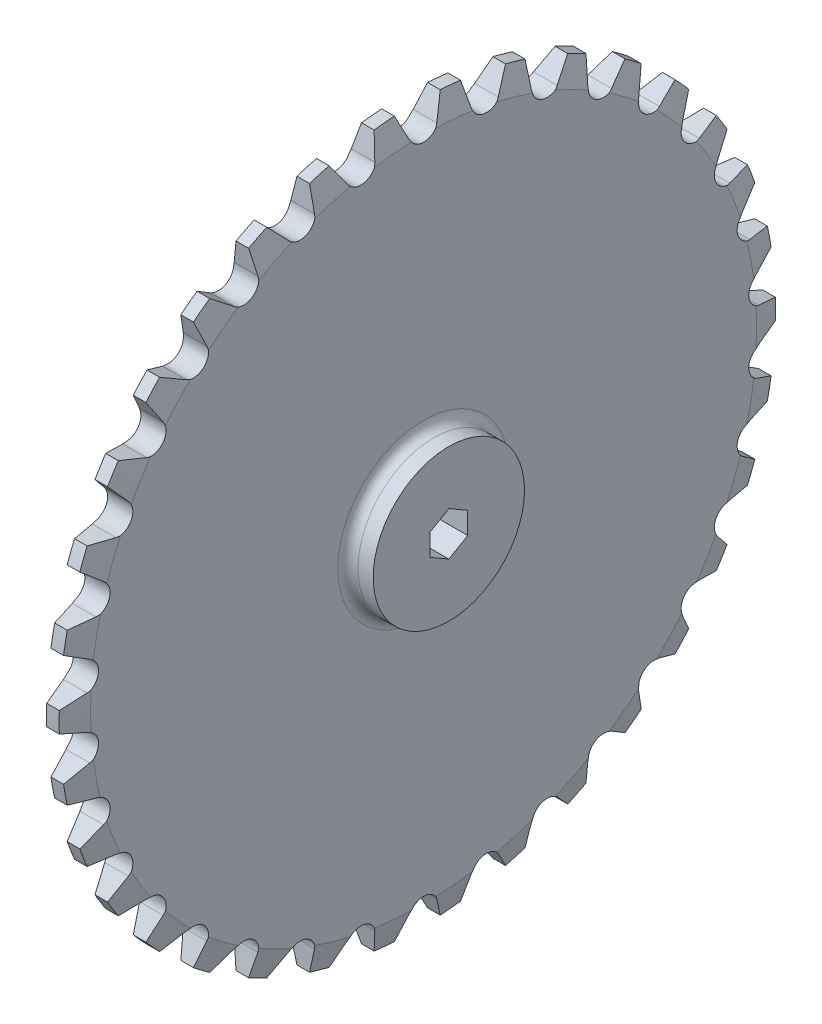
from build123d import *

# Parameters (mm, degrees)
CUT_EXTRUDE2_DEPTH      = 129.503982137
CIRPATTERN1_COUNT       = 34
CUT_EXTRUDE3_DEPTH      = 130.313516587
CUT_EXTRUDE3_DEPTH_BACK = 130.313516587
FILLET1_R               = 2.54


with BuildPart() as part:
    # Sketch1 → Revolve1 (revolve)
    with BuildSketch(Plane(origin=(0, 0, 0), x_dir=(1, 0, 0), z_dir=(0, 1, 0))):
        Polygon((-4.7625, 90.17), (-6.35, 83.82), (-6.35, 19.05), (-15.875, 19.05), (-15.875, 0), (6.35, 0), (6.35, 19.05), (0, 19.05), (0, 83.82), (-1.5875, 90.17), align=None)
    revolve(axis=Axis((0, 0, 0), (-1, 0, 0)))

    # Sketch2 → Cut-Extrude2 (cut, symmetric)
    with BuildSketch(Plane(origin=(0, 0, 0), x_dir=(0, 0, -1), z_dir=(1, 0, 0))):
        with BuildLine():
            ThreePointArc((-3.519981019, 84.568215737), (0, 82.216239614), (3.519981019, 84.568215737))
            Line((3.519981019, 84.568215737), (8.38006061, 96.3014858))
            Line((8.38006061, 96.3014858), (-8.38006061, 96.3014858))
            Line((-8.38006061, 96.3014858), (-3.519981019, 84.568215737))
        make_face()
    cut_extrude2 = extrude(amount=CUT_EXTRUDE2_DEPTH, both=True, mode=Mode.SUBTRACT)

    # CirPattern1: Cut-Extrude2 ×34 about axis
    cirpattern1_axis = Axis((6.35, 0, 0), (1, 0, 0))
    for i in range(1, CIRPATTERN1_COUNT):
        add(cut_extrude2.rotate(cirpattern1_axis, i * 360 / CIRPATTERN1_COUNT), mode=Mode.SUBTRACT)

    # Sketch3 → Cut-Extrude3 (cut, two sides: drawn at the far end of the back side and taken through both)
    with BuildSketch(Plane.ZY.offset(15.875).offset(-CUT_EXTRUDE3_DEPTH_BACK)):
        Polygon((0, 5.499261314), (-4.7625, 2.749630657), (-4.7625, -2.749630657), (0, -5.499261314), (4.7625, -2.749630657), (4.7625, 2.749630657), align=None)
    extrude(amount=CUT_EXTRUDE3_DEPTH + CUT_EXTRUDE3_DEPTH_BACK, mode=Mode.SUBTRACT)

    # Fillet1
    fillet1_edges = [part.edges().sort_by_distance(p)[0] for p in [
        (0, 0, 19.05),
        (-6.35, 0, 19.05),
    ]]
    fillet(fillet1_edges, radius=FILLET1_R)


solid = part.part
